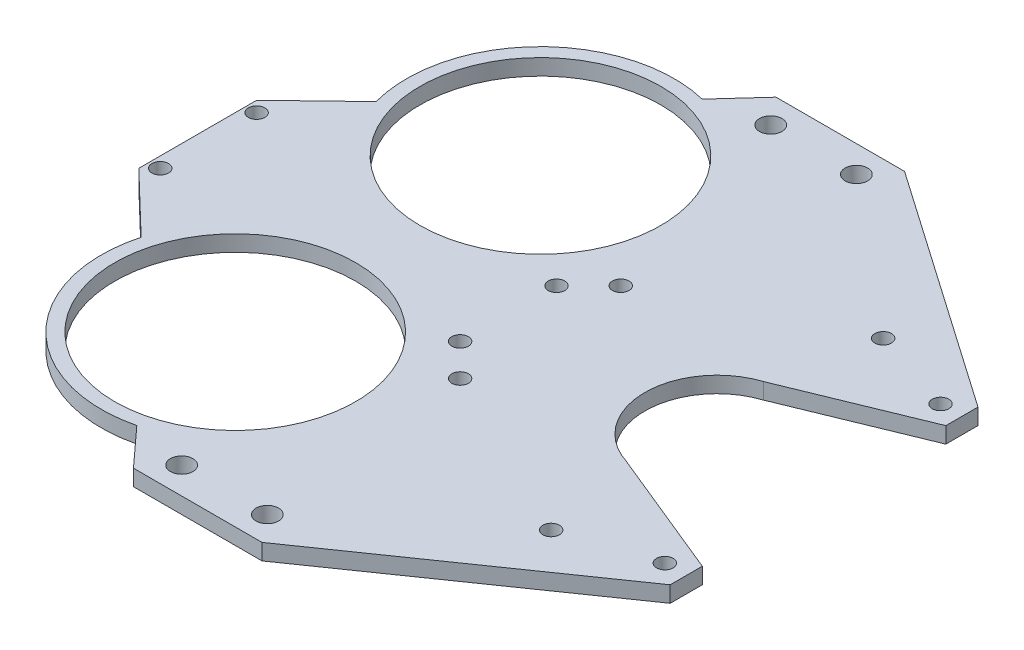
from build123d import *
from build123d.topology import SkipClean

# Parameters (mm, degrees)
SKETCH_1_R               = 1.55
SKETCH_1_R_2             = 4
EXTRUDE_1_DEPTH          = 3
EXTRUDE_START            = -3
SKETCH_2_R               = 2.1
EXTRUDE_3_DEPTH          = 3
FILLET_1_R               = 4
FILLET_2_R               = 314
FILLET_3_R               = 314
FILLET_4_R               = 4
CUT_EXTRUDE_2_DEPTH      = 3
EXTRUDE_4_DEPTH          = 3
CUT_EXTRUDE_START        = -10
SKETCH_5_R               = 22.5
CUT_EXTRUDE_3_DEPTH      = 10
SKETCH_6_R               = 13.5
EXTRUDE_5_DEPTH          = 3
EXTRUDE_6_DEPTH          = 3
CUT_EXTRUDE_5_DEPTH      = 98.662684788
CUT_EXTRUDE_5_DEPTH_BACK = 3
SKETCH_9_R               = 1.55
CUT_EXTRUDE_7_DEPTH      = 10
SKETCH_10_W              = 64.519287894
SKETCH_10_H              = 7.041569679
EXTRUDE_7_DEPTH          = 3
SKETCH_11_R              = 1.55
CUT_EXTRUDE_8_DEPTH      = 10


with BuildPart() as part:
    # 草图1 → 凸台-拉伸1 (new body)
    with BuildSketch(Plane(origin=(0, 0, 0), x_dir=(1, 0, 0), z_dir=(0, 1, 0))):
        with BuildLine():
            Line((-27.819418646, 37.14796354), (-55, 11))
            Line((-55, 11), (-55, -11))
            Line((-55, -11), (-27.819418646, -37.14796354))
            ThreePointArc((-27.819418646, -37.14796354), (-23.984664844, -39.630488814), (-19.5, -40.5))
            Line((-19.5, -40.5), (-17.421399483, -40.31860482))
            Line((-17.421399483, -40.31860482), (45.042813224, -34.867481809))
            ThreePointArc((45.042813224, -34.867481809), (58.724014778, -30.74585061), (69.617928959, -21.5))
            Line((69.617928959, -21.5), (19, -21.5))
            ThreePointArc((19, -21.5), (15.464466094, -20.035533906), (14, -16.5))
            Line((14, -16.5), (14, -12.539936204))
            ThreePointArc((14, -12.539936204), (5.5, 0), (14, 12.539936204))
            Line((14, 12.539936204), (14, 16.5))
            ThreePointArc((14, 16.5), (15.464466094, 20.035533906), (19, 21.5))
            Line((19, 21.5), (69.617928959, 21.5))
            ThreePointArc((69.617928959, 21.5), (58.724014778, 30.74585061), (45.042813224, 34.867481809))
            Line((45.042813224, 34.867481809), (-17.421399483, 40.31860482))
            Line((-17.421399483, 40.31860482), (-19.5, 40.5))
            ThreePointArc((-19.5, 40.5), (-23.984664844, 39.630488814), (-27.819418646, 37.14796354))
        make_face()
        with Locations(Location((-29, -28.5, 0), (0, 0, 270))):
            Circle(SKETCH_1_R, mode=Mode.SUBTRACT)
        with Locations(Location((-19.5, -36.5, 0), (0, 0, 270))):
            Circle(SKETCH_1_R, mode=Mode.SUBTRACT)
        with Locations(Location((-19.5, -28.5, 0), (0, 0, 270))):
            Circle(SKETCH_1_R_2, mode=Mode.SUBTRACT)
        with Locations(Location((-10, -28.5, 0), (0, 0, 270))):
            Circle(SKETCH_1_R, mode=Mode.SUBTRACT)
        with Locations(Location((-19.5, -20.5, 0), (0, 0, 270))):
            Circle(SKETCH_1_R, mode=Mode.SUBTRACT)
        with Locations(Location((-46.5, 0, 0), (0, 0, 270))):
            Circle(SKETCH_1_R, mode=Mode.SUBTRACT)
        with Locations(Location((-27.5, 0, 0), (0, 0, 270))):
            Circle(SKETCH_1_R, mode=Mode.SUBTRACT)
        with Locations(Location((0, 0, 0), (0, 0, 270))):
            Circle(SKETCH_1_R, mode=Mode.SUBTRACT)
        with Locations(Location((-29, 28.5, 0), (0, 0, 270))):
            Circle(SKETCH_1_R, mode=Mode.SUBTRACT)
        with Locations(Location((-19.5, 20.5, 0), (0, 0, 270))):
            Circle(SKETCH_1_R, mode=Mode.SUBTRACT)
        with Locations(Location((-19.5, 28.5, 0), (0, 0, 270))):
            Circle(SKETCH_1_R_2, mode=Mode.SUBTRACT)
        with Locations(Location((-10, 28.5, 0), (0, 0, 270))):
            Circle(SKETCH_1_R, mode=Mode.SUBTRACT)
        with Locations(Location((-19.5, 36.5, 0), (0, 0, 270))):
            Circle(SKETCH_1_R, mode=Mode.SUBTRACT)
    extrude(amount=EXTRUDE_1_DEPTH)

    # 草图2 → 凸台-拉伸3 (add)
    with BuildSketch(Plane(origin=(0, 3, 0), x_dir=(1, 0, 0), z_dir=(0, 1, 0)).offset(EXTRUDE_START)):
        with BuildLine():
            Line((-7, 60), (-28.363974347, 36.588878709))
            ThreePointArc((-28.363974347, 36.588878709), (-26.665503977, 38.125775437), (-24.705947863, 39.311942788))
            Line((-24.705947863, 39.311942788), (-19.656872495, 39.177623495))
            Line((-19.656872495, 39.177623495), (-17.421399483, 40.31860482))
            Line((-17.421399483, 40.31860482), (17, 37.314720281))
            Line((17, 37.314720281), (17, 50))
            Line((17, 50), (17, 60))
            Line((17, 60), (-7, 60))
        make_face()
        with Locations(Location((13, 55, 0), (0, 0, 270))):
            Circle(SKETCH_2_R, mode=Mode.SUBTRACT)
        with Locations(Location((-3, 55, 0), (0, 0, 270))):
            Circle(SKETCH_2_R, mode=Mode.SUBTRACT)
    extrude_3 = extrude(amount=EXTRUDE_3_DEPTH)

    # 圆角1
    fillet_1_edges = [part.edges().sort_by_distance(p)[0] for p in [
        (17, 1.5, -37.314720281),
    ]]
    fillet(fillet_1_edges, radius=FILLET_1_R)

    # 圆角2
    # the kernel refuses this fillet: 314 mm, written as the material it adds along each edge
    with BuildSketch(Plane(origin=(-28.100791786, 0, -36.877280051), x_dir=(0.6740732257670936, 0, -0.7386645289330906), z_dir=(0, 1, 0))) as fillet_2_piece_1:
        with BuildLine():
            CenterArc((FILLET_2_R * 0.032536346624, FILLET_2_R), FILLET_2_R, 266.272924122, 3.727075878)
            Line((-FILLET_2_R * 0.0324675326171, FILLET_2_R * 0.0021149887469), (0, 0))
            Line((0, 0), (FILLET_2_R * 0.032536346624, 0))
        make_face()
    extrude(amount=3)

    # 镜向2: 凸台-拉伸3 across plane
    add(extrude_3.mirror(Plane.XY))

    # 圆角3
    # the kernel refuses this fillet: 314 mm, written as the material it adds along each edge
    with BuildSketch(Plane(origin=(-28.100791786, 0, 36.877280051), x_dir=(-0.7206636283184775, 0, -0.6932848871992288), z_dir=(0, 1, 0))) as fillet_3_piece_1:
        with BuildLine():
            CenterArc((FILLET_3_R * 0.0325363466241, FILLET_3_R), FILLET_3_R, 266.272924122, 3.727075878)
            Line((-FILLET_3_R * 0.0324675326171, FILLET_3_R * 0.0021149887469), (0, 0))
            Line((0, 0), (FILLET_3_R * 0.032536346624, 0))
        make_face()
    extrude(amount=3)

    # 圆角4
    fillet_4_edges = [part.edges().sort_by_distance(p)[0] for p in [
        (17, 1.5, 37.314720281),
    ]]
    fillet(fillet_4_edges, radius=FILLET_4_R)

    # 草图3 → 切除-拉伸2 (cut)
    with BuildSketch(Plane.XZ):
        with BuildLine():
            ThreePointArc((-8.686732059, 48.231275591), (-35.637539634, 44.178960889), (-38.911435654, 17.122558906))
            ThreePointArc((-38.911435654, 17.122558906), (-32.411561674, 15.426493388), (-30.715496156, 21.926367368))
            ThreePointArc((-30.715496156, 21.926367368), (-28.823911789, 37.55895518), (-13.252334078, 39.900292563))
            ThreePointArc((-13.252334078, 39.900292563), (-6.804041555, 41.782983067), (-8.686732059, 48.231275591))
        make_face()
    cut_extrude_2 = extrude(amount=-CUT_EXTRUDE_2_DEPTH, mode=Mode.SUBTRACT)

    # 草图4 → 凸台-拉伸4 (add)
    with SkipClean():  # the faces are left unmerged after this step: merging them gives an invalid solid
        with BuildSketch(Plane.XZ):
            with BuildLine():
                Line((-43.624805935, 21.943038922), (-41.535713139, 23.952764967))
                ThreePointArc((-41.535713139, 23.952764967), (-35.617955509, 44.199092655), (-15.534428758, 50.647781937))
                Line((-15.534428758, 50.647781937), (-13.580394358, 52.78905657))
                ThreePointArc((-13.580394358, 52.78905657), (-37.408839455, 45.943436284), (-43.624805935, 21.943038922))
            make_face()
            with BuildLine():
                ThreePointArc((-25.118289886, 40.223259732), (-28.812596517, 37.570586867), (-31.367097826, 33.807729194))
                ThreePointArc((-31.367097826, 33.807729194), (-28.219819959, 36.993214998), (-25.118289886, 40.223259732))
            make_face()
        extrude_4 = extrude(amount=-EXTRUDE_4_DEPTH)

    # 镜向9: 切除-拉伸2, 凸台-拉伸4 across plane
    with SkipClean():  # the faces are left unmerged after this step: merging them gives an invalid solid
        add(cut_extrude_2.mirror(Plane.XY), mode=Mode.SUBTRACT)
        add(extrude_4.mirror(Plane.XY))

    # 草图5 → 切除-拉伸3 (cut)
    with SkipClean():  # the faces are left unmerged after this step: merging them gives an invalid solid
        with BuildSketch(Plane(origin=(0, 3, 0), x_dir=(1, 0, 0), z_dir=(0, 1, 0)).offset(CUT_EXTRUDE_START)):
            with Locations(Location((-19.5, 28.5, 0), (0, 0, 270))):
                Circle(SKETCH_5_R)
            with Locations(Location((-19.5, -28.5, 0), (0, 0, 90))):
                Circle(SKETCH_5_R)
        extrude(amount=CUT_EXTRUDE_3_DEPTH, mode=Mode.SUBTRACT)

    # 草图6 → 凸台-拉伸5 (add)
    with SkipClean():  # the faces are left unmerged after this step: merging them gives an invalid solid
        with BuildSketch(Plane(origin=(0, 3, 0), x_dir=(1, 0, 0), z_dir=(0, 1, 0)).offset(EXTRUDE_START)):
            with BuildLine():
                ThreePointArc((7.831521739, -7.583870604), (77, 0), (7.831521739, 7.583870604))
                ThreePointArc((7.831521739, 7.583870604), (5.5, 0), (7.831521739, -7.583870604))
            make_face()
            with Locations(Location((42, 0, 0), (0, 0, 270))):
                Circle(SKETCH_6_R, mode=Mode.SUBTRACT)
        extrude(amount=EXTRUDE_5_DEPTH)

    # 草图7 → 凸台-拉伸6 (add)
    with SkipClean():  # the faces are left unmerged after this step: merging them gives an invalid solid
        with BuildSketch(Plane(origin=(0, 3, 0), x_dir=(1, 0, 0), z_dir=(0, 1, 0)).offset(EXTRUDE_START)):
            with BuildLine():
                Line((17, 60), (61.975534644, 28.739833258))
                ThreePointArc((61.975534644, 28.739833258), (53.910000161, 32.911273086), (45.042813224, 34.867481809))
                Line((45.042813224, 34.867481809), (20.652249917, 36.995995963))
                ThreePointArc((20.652249917, 36.995995963), (18.051186651, 38.278167206), (17, 40.980851027))
                Line((17, 40.980851027), (17, 60))
            make_face()
            with BuildLine():
                Line((17, -60), (61.975557807, -28.739817159))
                ThreePointArc((61.975557807, -28.739817159), (53.910013423, -32.911268287), (45.042813224, -34.867481809))
                Line((45.042813224, -34.867481809), (20.652249917, -36.995995963))
                ThreePointArc((20.652249917, -36.995995963), (18.051186651, -38.278167206), (17, -40.980851027))
                Line((17, -40.980851027), (17, -60))
            make_face()
        extrude(amount=EXTRUDE_6_DEPTH)

    # 草图8 → 切除-拉伸5 (cut, two sides: drawn at the far end of the back side and taken through both)
    with SkipClean():  # the faces are left unmerged after this step: merging them gives an invalid solid
        with BuildSketch(Plane(origin=(0, 3, 0), x_dir=(1, 0, 0), z_dir=(0, 1, 0)).offset(-CUT_EXTRUDE_5_DEPTH_BACK)):
            with BuildLine():
                Line((61.975534644, 28.739833258), (61.975534644, 22.739833258))
                Line((61.975534644, 22.739833258), (35.963826017, 12.075371781))
                Line((35.963826017, 12.075371781), (35.963826017, -12.075371781))
                Line((35.963826017, -12.075371781), (61.975534644, -22.739833258))
                Line((61.975534644, -22.739833258), (61.975534644, -28.739833258))
                ThreePointArc((61.975534644, -28.739833258), (77, 1.4104e-05), (61.975534644, 28.739833258))
            make_face()
        extrude(amount=CUT_EXTRUDE_5_DEPTH + CUT_EXTRUDE_5_DEPTH_BACK, mode=Mode.SUBTRACT)

    # 草图9 → 切除-拉伸7 (cut)
    with SkipClean():  # the faces are left unmerged after this step: merging them gives an invalid solid
        with BuildSketch(Plane(origin=(0, 3, 0), x_dir=(1, 0, 0), z_dir=(0, 1, 0))):
            with Locations(Location((-53, -9, 0), (0, 0, 270))):
                Circle(SKETCH_9_R)
            with Locations(Location((-53, 9, 0), (0, 0, 270))):
                Circle(SKETCH_9_R)
            with Locations(Location((3, 9, 0), (0, 0, 270))):
                Circle(SKETCH_9_R)
            with Locations(Location((3, -9, 0), (0, 0, 270))):
                Circle(SKETCH_9_R)
        extrude(amount=-CUT_EXTRUDE_7_DEPTH, mode=Mode.SUBTRACT)

    # 草图10 → 凸台-拉伸7 (add)
    with SkipClean():  # the faces are left unmerged after this step: merging them gives an invalid solid
        with BuildSketch(Plane(origin=(0, 3, 0), x_dir=(1, 0, 0), z_dir=(0, 1, 0))):
            with Locations((-17.723905758, 0.445902683)):
                Rectangle(SKETCH_10_W, SKETCH_10_H)
        extrude(amount=-EXTRUDE_7_DEPTH)

    # 草图11 → 切除-拉伸8 (cut)
    with SkipClean():  # the faces are left unmerged after this step: merging them gives an invalid solid
        with BuildSketch(Plane(origin=(0, 3, 0), x_dir=(1, 0, 0), z_dir=(0, 1, 0))):
            with Locations(Location((57.975534644, 25.739833258, 0), (0, 0, 270))):
                Circle(SKETCH_11_R)
            with Locations(Location((42, 31, 0), (0, 0, 270))):
                Circle(SKETCH_11_R)
            with Locations(Location((9, 15, 0), (0, 0, 270))):
                Circle(SKETCH_11_R)
        cut_extrude_8 = extrude(amount=-CUT_EXTRUDE_8_DEPTH, mode=Mode.SUBTRACT)

    # 镜向10: 切除-拉伸8 across plane
    with SkipClean():  # the faces are left unmerged after this step: merging them gives an invalid solid
        add(cut_extrude_8.mirror(Plane.XY), mode=Mode.SUBTRACT)


solid = part.part
